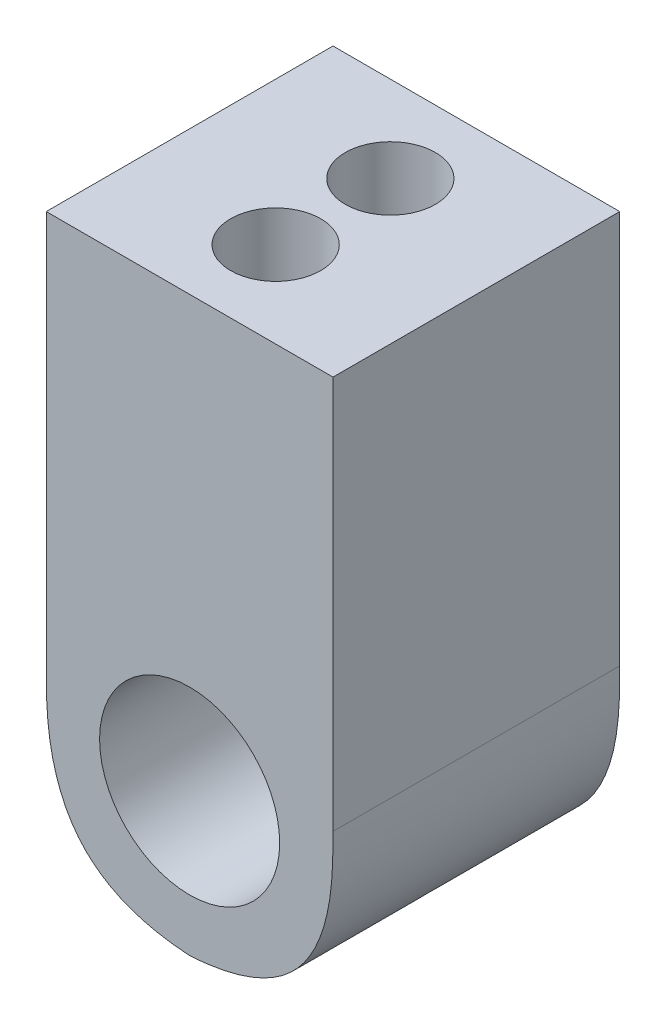
from build123d import *

# Parameters (mm, degrees)
SKETCH1_W           = 12.7
SKETCH1_H           = 12.7
SKETCH1_R           = 3.9878
BOSS_EXTRUDE1_DEPTH = 12.7
FILLET1_SIZE        = 7.9756
CUT_EXTRUDE2_DEPTH  = 6.35
SKETCH1_3_R         = 3.9878
CUT_EXTRUDE3_DEPTH  = 24.759524566


with BuildPart() as part:
    # Sketch1 → Boss-Extrude1 (new body)
    # profile 1 of 3: a face of its own
    with BuildSketch(Plane.XY):
        with Locations((0, 12.7)):
            Rectangle(SKETCH1_W, SKETCH1_H)
    # profile 2 of 3: a face of its own
    with BuildSketch(Plane.XY):
        Rectangle(SKETCH1_W, SKETCH1_H)
        Circle(SKETCH1_R, mode=Mode.SUBTRACT)
    # profile 3 of 3: a face of its own
    with BuildSketch(Plane.XY):
        Circle(SKETCH1_R)
    extrude(amount=-BOSS_EXTRUDE1_DEPTH)

    # Fillet1
    # a fillet whose section is not a circle: 7.9756 mm, written as the material it takes off along each edge
    with BuildSketch(Plane(origin=(-6.35, -6.35, 19.939), x_dir=(1, 0, 0), z_dir=(0, 0, -1)), Plane(origin=(6.35, -6.35, 19.939), x_dir=(0, 1, 0), z_dir=(0, 0, -1))) as fillet1_piece_1:
        with BuildLine():
            add(Edge.make_bspline([(FILLET1_SIZE, 0), (FILLET1_SIZE * 0.831801948466, 0), (FILLET1_SIZE * 0.663603896932, 0), (FILLET1_SIZE * 0.292893218813, -FILLET1_SIZE * 0.0716919198361), (FILLET1_SIZE * 0.0716919198361, -FILLET1_SIZE * 0.292893218813), (0, -FILLET1_SIZE * 0.663603896932), (0, -FILLET1_SIZE * 0.831801948466), (0, -FILLET1_SIZE)], knots=[0, 0, 0, 0, 0, 0, 0.5, 0.5, 1, 1, 1, 1, 1, 1], degree=5))
            Line((0, -FILLET1_SIZE), (0, 0))
            Line((0, 0), (FILLET1_SIZE, 0))
        make_face()
    extrude(amount=52.578, mode=Mode.SUBTRACT)

    # Sketch3 → Cut-Extrude2 (cut)
    with BuildSketch(Plane(origin=(0, 19.05, 0), x_dir=(1, 0, 0), z_dir=(0, 1, 0))):
        with BuildLine():
            ThreePointArc((1.9939, 8.89), (1.409900211, 10.299900211), (0, 10.8839))
            Line((0, 10.8839), (0, 8.89))
            Line((0, 8.89), (1.9939, 8.89))
        make_face()
        with BuildLine():
            Line((0, 8.89), (0, 10.8839))
            ThreePointArc((0, 10.8839), (-1.409900211, 10.299900211), (-1.9939, 8.89))
            Line((-1.9939, 8.89), (0, 8.89))
        make_face()
        with BuildLine():
            Line((1.9939, 8.89), (0, 8.89))
            Line((0, 8.89), (0, 6.8961))
            ThreePointArc((0, 6.8961), (1.409900211, 7.480099789), (1.9939, 8.89))
        make_face()
        with BuildLine():
            Line((0, 6.8961), (0, 8.89))
            Line((0, 8.89), (-1.9939, 8.89))
            ThreePointArc((-1.9939, 8.89), (-1.409900211, 7.480099789), (0, 6.8961))
        make_face()
        with BuildLine():
            ThreePointArc((1.9939, 3.81), (1.409900211, 5.219900211), (0, 5.8039))
            Line((0, 5.8039), (0, 3.81))
            Line((0, 3.81), (1.9939, 3.81))
        make_face()
        with BuildLine():
            Line((0, 3.81), (0, 5.8039))
            ThreePointArc((0, 5.8039), (-1.409900211, 5.219900211), (-1.9939, 3.81))
            Line((-1.9939, 3.81), (0, 3.81))
        make_face()
        with BuildLine():
            ThreePointArc((0, 1.8161), (1.409900211, 2.400099789), (1.9939, 3.81))
            Line((1.9939, 3.81), (0, 3.81))
            Line((0, 3.81), (0, 1.8161))
        make_face()
        with BuildLine():
            Line((0, 3.81), (-1.9939, 3.81))
            ThreePointArc((-1.9939, 3.81), (-1.409900211, 2.400099789), (0, 1.8161))
            Line((0, 1.8161), (0, 3.81))
        make_face()
    extrude(amount=-CUT_EXTRUDE2_DEPTH, mode=Mode.SUBTRACT)

    # Sketch1<3> → Cut-Extrude3 (cut, through all)
    with BuildSketch(Plane.XY):
        Circle(SKETCH1_3_R)
    extrude(amount=-CUT_EXTRUDE3_DEPTH, mode=Mode.SUBTRACT)


solid = part.part
